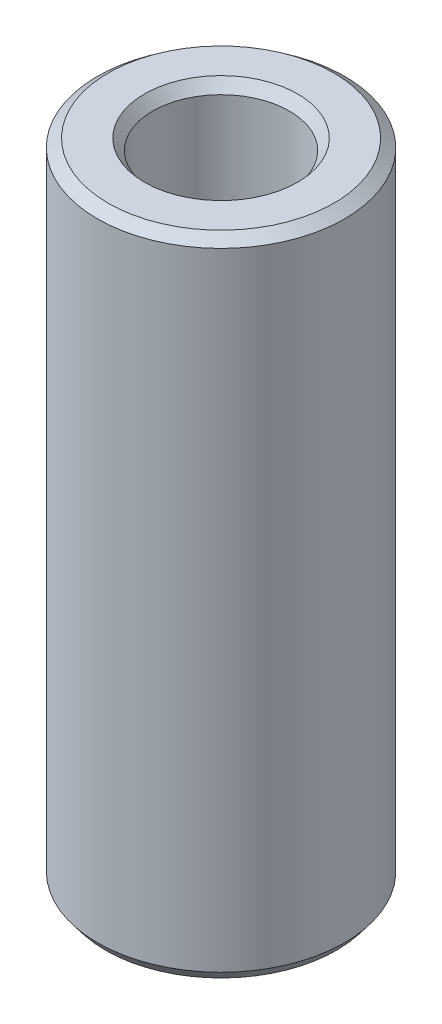
from build123d import *
from OCP.BRepFilletAPI import BRepFilletAPI_MakeChamfer

# Parameters (mm, degrees)
SKETCH1_R           = 57.5
BOSS_EXTRUDE1_DEPTH = 300.527660437
SKETCH2_R           = 31.823168288
CUT_EXTRUDE1_DEPTH  = 312.334827297
CHAMFER1_SIZE       = 3.809156005
CHAMFER1_SIZE2      = 4.99300745


with BuildPart() as part:
    # Sketch1 → Boss-Extrude1 (new body)
    with BuildSketch(Plane(origin=(0, 0, 0), x_dir=(1, 0, 0), z_dir=(0, 1, 0))):
        Circle(SKETCH1_R)
    extrude(amount=BOSS_EXTRUDE1_DEPTH)

    # Sketch2 → Cut-Extrude1 (cut, through all)
    with BuildSketch(Plane(origin=(0, 0, 0), x_dir=(1, 0, 0), z_dir=(0, 1, 0))):
        Circle(SKETCH2_R)
    extrude(amount=CUT_EXTRUDE1_DEPTH, mode=Mode.SUBTRACT)

    # Chamfer1: one chamfer whose edges measure the first distance from different faces: ONE call of the kernel's chamfer builder (chamfer() names one face for all edges)
    chamfer1_edges_1 = [part.edges().sort_by_distance(p)[0] for p in [
        (-31.823168288, 300.527660437, 0),
    ]]
    chamfer1_side_1 = [part.faces().sort_by_distance(p)[0] for p in [
        (-55.873654403, 300.527660437, 0),
    ]]
    chamfer1_edges_2 = [part.edges().sort_by_distance(p)[0] for p in [
        (-31.823168288, 0, 0),
    ]]
    chamfer1_side_2 = [part.faces().sort_by_distance(p)[0] for p in [
        (-31.823168288, 150.263830219, 0),
    ]]
    chamfer1_edges_3 = [part.edges().sort_by_distance(p)[0] for p in [
        (-57.5, 0, 0),
    ]]
    chamfer1_side_3 = [part.faces().sort_by_distance(p)[0] for p in [
        (-55.873654403, 0, 0),
    ]]
    chamfer1_edges_4 = [part.edges().sort_by_distance(p)[0] for p in [
        (-57.5, 300.527660437, 0),
    ]]
    chamfer1_side_4 = [part.faces().sort_by_distance(p)[0] for p in [
        (-57.5, 150.263830219, 0),
    ]]
    chamfer1 = BRepFilletAPI_MakeChamfer(part.part.solid().wrapped)
    for e in chamfer1_edges_1:
        chamfer1.Add(CHAMFER1_SIZE, CHAMFER1_SIZE2, e.wrapped, chamfer1_side_1[0].wrapped)  # the first distance lies on this face
    for e in chamfer1_edges_2:
        chamfer1.Add(CHAMFER1_SIZE, CHAMFER1_SIZE2, e.wrapped, chamfer1_side_2[0].wrapped)  # the first distance lies on this face
    for e in chamfer1_edges_3:
        chamfer1.Add(CHAMFER1_SIZE, CHAMFER1_SIZE2, e.wrapped, chamfer1_side_3[0].wrapped)  # the first distance lies on this face
    for e in chamfer1_edges_4:
        chamfer1.Add(CHAMFER1_SIZE, CHAMFER1_SIZE2, e.wrapped, chamfer1_side_4[0].wrapped)  # the first distance lies on this face
    add(Compound.cast(chamfer1.Shape()), mode=Mode.REPLACE)


solid = part.part
